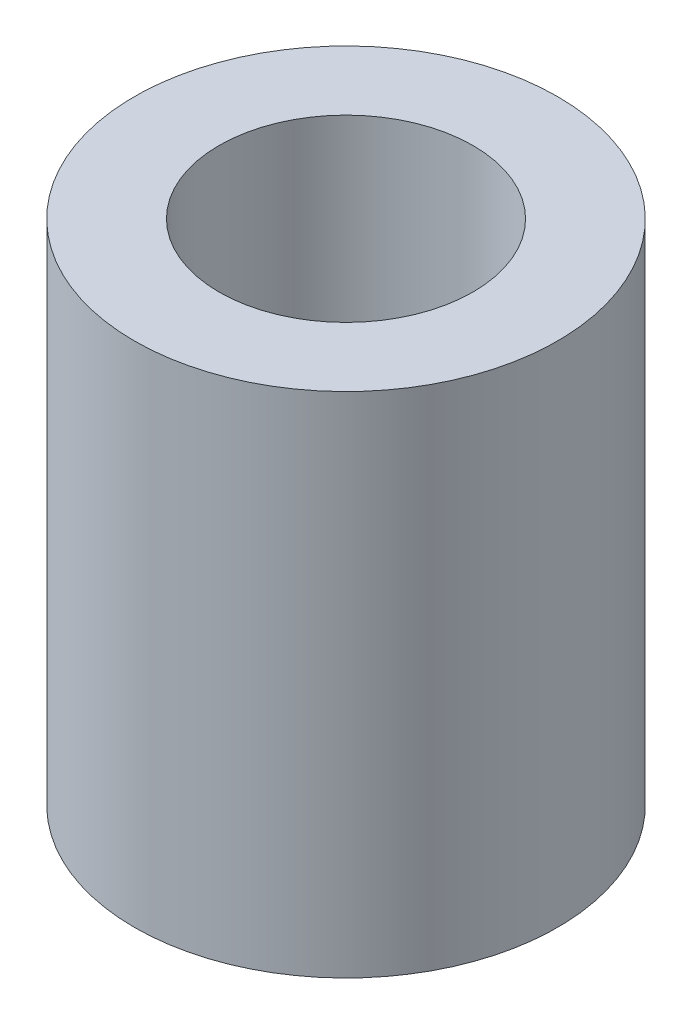
from build123d import *

# Parameters (mm, degrees)
SKETCH1_R           = 15.875
SKETCH1_R_2         = 9.525
BOSS_EXTRUDE1_DEPTH = 38.1


with BuildPart() as part:
    # Sketch1 → Boss-Extrude1 (new body)
    with BuildSketch(Plane(origin=(0, 0, 0), x_dir=(1, 0, 0), z_dir=(0, 1, 0))):
        Circle(SKETCH1_R)
        Circle(SKETCH1_R_2, mode=Mode.SUBTRACT)
    extrude(amount=BOSS_EXTRUDE1_DEPTH)


solid = part.part
